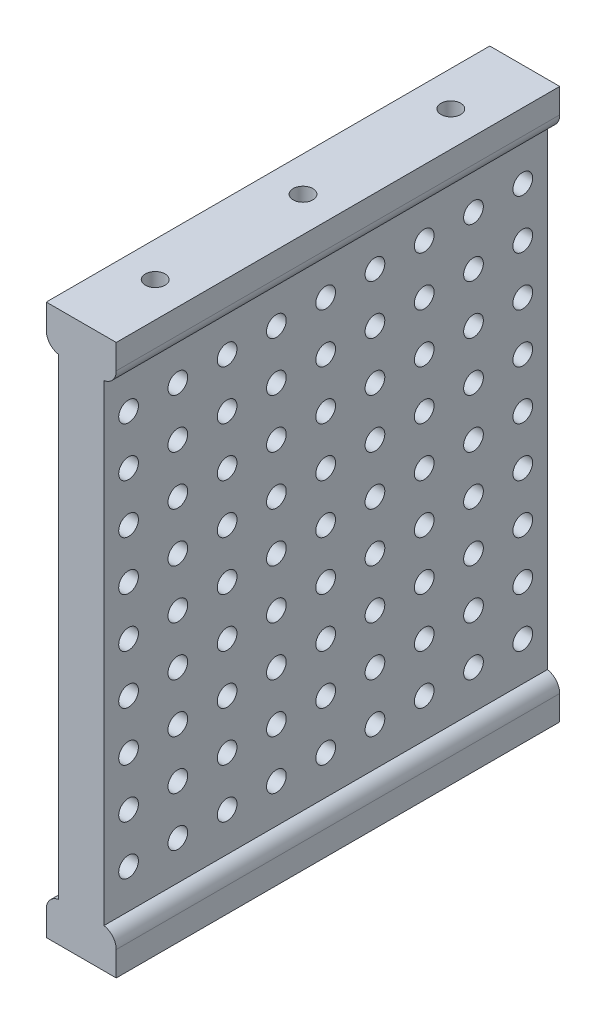
from build123d import *

# Parameters (mm, degrees)
RESSALTO_EXTRUS_O2_DEPTH   = 90
CORTE_EXTRUS_O1_DEPTH      = 90
CORTE_EXTRUS_O1_DEPTH_BACK = 90
ESBO_O3_R                  = 2
CORTE_EXTRUS_O2_DEPTH      = 90
CORTE_EXTRUS_O2_DEPTH_BACK = 90
ESBO_O4_R                  = 2
CORTE_EXTRUS_O3_DEPTH      = 53
CORTE_EXTRUS_O3_DEPTH_BACK = 22
ESBO_O5_R                  = 2


with BuildPart() as part:
    # Esboço1 → Ressalto-extrusão2 (new body)
    with BuildSketch(Plane.XY):
        with BuildLine():
            Line((10.950035456, -73.171439877), (10.950035456, -73.129479769))
            Line((10.950035456, -73.129479769), (10.950035456, 22.61248034))
            ThreePointArc((10.950035456, 22.61248034), (12.741323303, 23.634028558), (13.450035456, 25.570520231))
            Line((13.450035456, 25.570520231), (13.450035456, 30.570520231))
            Line((13.450035456, 30.570520231), (10.950035456, 30.570520231))
            Line((10.950035456, 30.570520231), (1.750035456, 30.570520231))
            Line((1.750035456, 30.570520231), (-0.749964544, 30.570520231))
            Line((-0.749964544, 30.570520231), (-0.749964544, 25.570520231))
            ThreePointArc((-0.749964544, 25.570520231), (-0.041252392, 23.634028558), (1.750035456, 22.61248034))
            Line((1.750035456, 22.61248034), (1.750035456, -73.129479769))
            Line((1.750035456, -73.129479769), (1.750035456, -73.171439877))
            ThreePointArc((1.750035456, -73.171439877), (-0.041252392, -74.192988096), (-0.749964544, -76.129479769))
            Line((-0.749964544, -76.129479769), (-0.749964544, -81.129479769))
            Line((-0.749964544, -81.129479769), (13.450035456, -81.129479769))
            Line((13.450035456, -81.129479769), (13.450035456, -76.129479769))
            ThreePointArc((13.450035456, -76.129479769), (12.741323303, -74.192988096), (10.950035456, -73.171439877))
        make_face()
    extrude(amount=RESSALTO_EXTRUS_O2_DEPTH)

    # Esboço3 → Corte-extrusão1 (cut, two sides: drawn at the far end of the back side and taken through both)
    with BuildSketch(Plane(origin=(0, 0, 0), x_dir=(1, 0, 0), z_dir=(0, 1, 0)).offset(-CORTE_EXTRUS_O1_DEPTH_BACK)):
        with Locations((6.350035456, -45)):
            Circle(ESBO_O3_R)
        with Locations((6.350035456, -15)):
            Circle(ESBO_O3_R)
        with Locations((6.350035456, -75)):
            Circle(ESBO_O3_R)
    extrude(amount=CORTE_EXTRUS_O1_DEPTH + CORTE_EXTRUS_O1_DEPTH_BACK, mode=Mode.SUBTRACT)

    # Esboço4 → Corte-extrusão2 (cut, two sides: drawn at the far end of the back side and taken through both)
    with BuildSketch(Plane(origin=(0, 0, 0), x_dir=(0, 0, -1), z_dir=(1, 0, 0)).offset(-CORTE_EXTRUS_O2_DEPTH_BACK)):
        with Locations((-25, -25.279479769)):
            Circle(ESBO_O4_R)
        with Locations((-15, -25.279479769)):
            Circle(ESBO_O4_R)
        with Locations((-5, -25.279479769)):
            Circle(ESBO_O4_R)
        with Locations((-35, -35.279479769)):
            Circle(ESBO_O4_R)
        with Locations((-25, -35.279479769)):
            Circle(ESBO_O4_R)
        with Locations((-15, -35.279479769)):
            Circle(ESBO_O4_R)
        with Locations((-5, -35.279479769)):
            Circle(ESBO_O4_R)
        with Locations((-35, -45.279479769)):
            Circle(ESBO_O4_R)
        with Locations((-25, -45.279479769)):
            Circle(ESBO_O4_R)
        with Locations((-15, -45.279479769)):
            Circle(ESBO_O4_R)
        with Locations((-5, -45.279479769)):
            Circle(ESBO_O4_R)
        with Locations((-35, -55.279479769)):
            Circle(ESBO_O4_R)
        with Locations((-25, -55.279479769)):
            Circle(ESBO_O4_R)
        with Locations((-35, -65.279479769)):
            Circle(ESBO_O4_R)
        with Locations((-25, -65.279479769)):
            Circle(ESBO_O4_R)
        with Locations((-15, -65.279479769)):
            Circle(ESBO_O4_R)
        with Locations((-5, -65.279479769)):
            Circle(ESBO_O4_R)
        with Locations((-45, -35.279479769)):
            Circle(ESBO_O4_R)
        with Locations((-45, -45.279479769)):
            Circle(ESBO_O4_R)
        with Locations((-45, -55.279479769)):
            Circle(ESBO_O4_R)
        with Locations((-45, -65.279479769)):
            Circle(ESBO_O4_R)
        with Locations((-55, -25.279479769)):
            Circle(ESBO_O4_R)
        with Locations((-65, -25.279479769)):
            Circle(ESBO_O4_R)
        with Locations((-75, -25.279479769)):
            Circle(ESBO_O4_R)
        with Locations((-85, -25.279479769)):
            Circle(ESBO_O4_R)
        with Locations((-55, -15.279479769)):
            Circle(ESBO_O4_R)
        with Locations((-65, -15.279479769)):
            Circle(ESBO_O4_R)
        with Locations((-75, -15.279479769)):
            Circle(ESBO_O4_R)
        with Locations((-85, -15.279479769)):
            Circle(ESBO_O4_R)
        with Locations((-55, -5.279479769)):
            Circle(ESBO_O4_R)
        with Locations((-65, -5.279479769)):
            Circle(ESBO_O4_R)
        with Locations((-75, -5.279479769)):
            Circle(ESBO_O4_R)
        with Locations((-85, -5.279479769)):
            Circle(ESBO_O4_R)
        with Locations((-55, 4.720520231)):
            Circle(ESBO_O4_R)
        with Locations((-65, 4.720520231)):
            Circle(ESBO_O4_R)
        with Locations((-75, 4.720520231)):
            Circle(ESBO_O4_R)
        with Locations((-85, 4.720520231)):
            Circle(ESBO_O4_R)
        with Locations((-55, 14.720520231)):
            Circle(ESBO_O4_R)
        with Locations((-65, 14.720520231)):
            Circle(ESBO_O4_R)
        with Locations((-75, 14.720520231)):
            Circle(ESBO_O4_R)
        with Locations((-85, 14.720520231)):
            Circle(ESBO_O4_R)
        with Locations((-45, -15.279479769)):
            Circle(ESBO_O4_R)
        with Locations((-45, -5.279479769)):
            Circle(ESBO_O4_R)
        with Locations((-45, 4.720520231)):
            Circle(ESBO_O4_R)
        with Locations((-45, 14.720520231)):
            Circle(ESBO_O4_R)
        with Locations((-35, -15.279479769)):
            Circle(ESBO_O4_R)
        with Locations((-35, -5.279479769)):
            Circle(ESBO_O4_R)
        with Locations((-35, 4.720520231)):
            Circle(ESBO_O4_R)
        with Locations((-35, 14.720520231)):
            Circle(ESBO_O4_R)
        with Locations((-25, -15.279479769)):
            Circle(ESBO_O4_R)
        with Locations((-25, -5.279479769)):
            Circle(ESBO_O4_R)
        with Locations((-25, 4.720520231)):
            Circle(ESBO_O4_R)
        with Locations((-25, 14.720520231)):
            Circle(ESBO_O4_R)
        with Locations((-15, -15.279479769)):
            Circle(ESBO_O4_R)
        with Locations((-15, -5.279479769)):
            Circle(ESBO_O4_R)
        with Locations((-15, 4.720520231)):
            Circle(ESBO_O4_R)
        with Locations((-15, 14.720520231)):
            Circle(ESBO_O4_R)
        with Locations((-5, -15.279479769)):
            Circle(ESBO_O4_R)
        with Locations((-5, -5.279479769)):
            Circle(ESBO_O4_R)
        with Locations((-5, 4.720520231)):
            Circle(ESBO_O4_R)
        with Locations((-5, 14.720520231)):
            Circle(ESBO_O4_R)
        with Locations((-55, -35.279479769)):
            Circle(ESBO_O4_R)
        with Locations((-55, -45.279479769)):
            Circle(ESBO_O4_R)
        with Locations((-55, -65.279479769)):
            Circle(ESBO_O4_R)
        with Locations((-65, -35.279479769)):
            Circle(ESBO_O4_R)
        with Locations((-65, -45.279479769)):
            Circle(ESBO_O4_R)
        with Locations((-65, -55.279479769)):
            Circle(ESBO_O4_R)
        with Locations((-65, -65.279479769)):
            Circle(ESBO_O4_R)
        with Locations((-75, -35.279479769)):
            Circle(ESBO_O4_R)
        with Locations((-75, -45.279479769)):
            Circle(ESBO_O4_R)
        with Locations((-75, -55.279479769)):
            Circle(ESBO_O4_R)
        with Locations((-75, -65.279479769)):
            Circle(ESBO_O4_R)
        with Locations((-85, -35.279479769)):
            Circle(ESBO_O4_R)
        with Locations((-85, -45.279479769)):
            Circle(ESBO_O4_R)
        with Locations((-85, -55.279479769)):
            Circle(ESBO_O4_R)
        with Locations((-85, -65.279479769)):
            Circle(ESBO_O4_R)
    extrude(amount=CORTE_EXTRUS_O2_DEPTH + CORTE_EXTRUS_O2_DEPTH_BACK, mode=Mode.SUBTRACT)

    # Esboço5 → Corte-extrusão3 (cut, two sides: drawn at the far end of the back side and taken through both)
    with BuildSketch(Plane(origin=(0, 0, 0), x_dir=(0, 0, -1), z_dir=(1, 0, 0)).offset(-CORTE_EXTRUS_O3_DEPTH_BACK)):
        with Locations((-45, -25.279479769)):
            Circle(ESBO_O5_R)
        with Locations((-35, -25.279479769)):
            Circle(ESBO_O5_R)
        with Locations((-15, -55.279479769)):
            Circle(ESBO_O5_R)
        with Locations((-5, -55.279479769)):
            Circle(ESBO_O5_R)
        with Locations((-55, -55.279479769)):
            Circle(ESBO_O5_R)
    extrude(amount=CORTE_EXTRUS_O3_DEPTH + CORTE_EXTRUS_O3_DEPTH_BACK, mode=Mode.SUBTRACT)


solid = part.part
